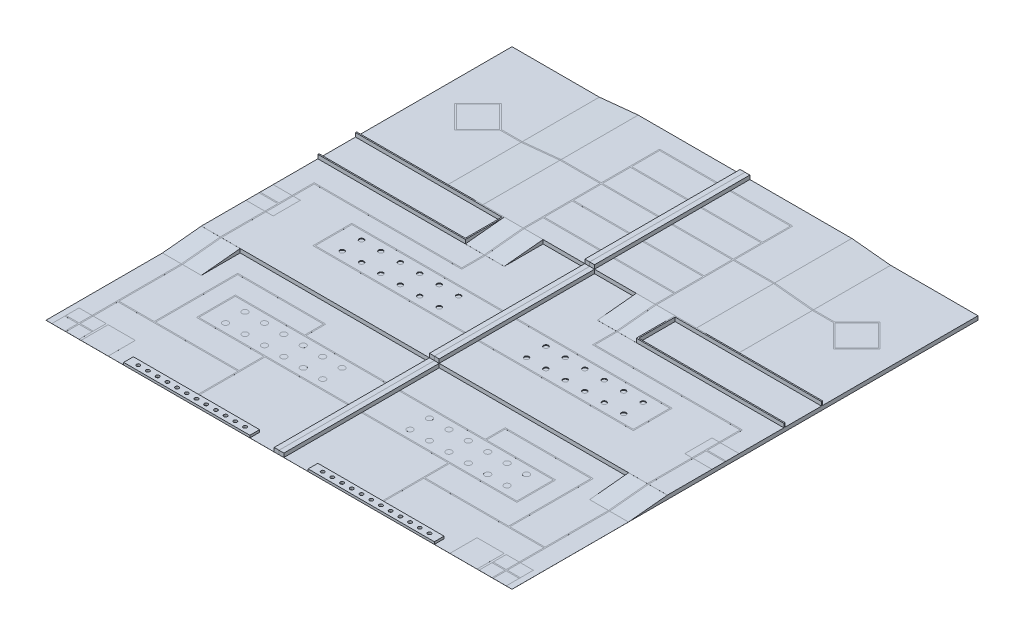
from build123d import *

# Parameters (mm, degrees)
SKETCH1_W            = 6000
SKETCH1_H            = 1
BOSS_EXTRUDE1_DEPTH  = 6000
SKETCH15_W           = 125
SKETCH15_H           = 12000
BOSS_EXTRUDE5_DEPTH  = 300
SKETCH17_W           = 5875
SKETCH17_H           = 4000
BOSS_EXTRUDE6_DEPTH  = 200
SKETCH19_W           = 5875
SKETCH19_H           = 4000
BOSS_EXTRUDE7_DEPTH  = 100
SKETCH20_W           = 700
SKETCH20_H           = 700
BOSS_EXTRUDE8_DEPTH  = 0.1
BOSS_EXTRUDE9_DEPTH  = 0.1
SKETCH23_W           = 700
SKETCH23_H           = 700
BOSS_EXTRUDE10_DEPTH = 0.1
SKETCH24_W           = 3250
SKETCH24_H           = 250
BOSS_EXTRUDE11_DEPTH = 60
SKETCH25_R           = 45
CUT_EXTRUDE2_DEPTH   = 59.5
BOSS_EXTRUDE15_DEPTH = 0.1
CUT_EXTRUDE3_DEPTH   = 0.1
SKETCH28_W           = 1000
SKETCH28_H           = 1000
BOSS_EXTRUDE16_DEPTH = 99
CHAMFER1_SIZE        = 98.999840601
CHAMFER1_SIZE_2      = 1000
SKETCH30_W           = 30
SKETCH30_H           = 1004.888551035
BOSS_EXTRUDE17_DEPTH = 0.1
SKETCH32_W           = 700
SKETCH32_H           = 700
BOSS_EXTRUDE18_DEPTH = 0.1
BOSS_EXTRUDE19_DEPTH = 0.1
BOSS_EXTRUDE20_DEPTH = 0.1
SKETCH29_R           = 75
BOSS_EXTRUDE21_DEPTH = 0.1
SKETCH35_W           = 30
SKETCH35_H           = 1150.009851823
BOSS_EXTRUDE22_DEPTH = 0.1
SKETCH36_W           = 1000
SKETCH36_H           = 1000
BOSS_EXTRUDE23_DEPTH = 100.01
BOSS_EXTRUDE24_DEPTH = 100.1
CHAMFER2_SIZE2       = 98.999840601
CHAMFER2_SIZE        = 1000
SKETCH39_W           = 30
SKETCH39_H           = 1004.988054447
BOSS_EXTRUDE25_DEPTH = 0.1
SKETCH40_R           = 60
CUT_EXTRUDE4_DEPTH   = 20
LPATTERN1_COUNT      = 6
LPATTERN1_PITCH      = 500
SKETCH41_W           = 2250
SKETCH41_H           = 4000
CUT_EXTRUDE5_DEPTH   = 100
CHAMFER4_SIZE        = 1000
CHAMFER4_SIZE2       = 99.989526659
BOSS_EXTRUDE27_DEPTH = 0.01
SKETCH44_W           = 1004.987514964
SKETCH44_H           = 30
BOSS_EXTRUDE28_DEPTH = 0.01
BOSS_EXTRUDE30_DEPTH = 0.1
SKETCH48_W           = 125
SKETCH48_H           = 4000
CUT_EXTRUDE8_DEPTH   = 200
SKETCH49_W           = 125
SKETCH49_H           = 4000
CUT_EXTRUDE9_DEPTH   = 100


# Some blends are built 0.0001 mm under size
with BuildPart() as part:
    # Sketch1 → Boss-Extrude1 (new, symmetric)
    with BuildSketch(Plane.XY):
        with Locations((3000, 0.5)):
            Rectangle(SKETCH1_W, SKETCH1_H)
    extrude(amount=BOSS_EXTRUDE1_DEPTH, both=True)

    # Sketch15 → Boss-Extrude5 (add)
    with BuildSketch(Plane(origin=(0, 1, 0), x_dir=(1, 0, 0), z_dir=(0, 1, 0))):
        with Locations((62.5, 0)):
            Rectangle(SKETCH15_W, SKETCH15_H)
    extrude(amount=BOSS_EXTRUDE5_DEPTH)

    # Sketch17 → Boss-Extrude6 (add)
    with BuildSketch(Plane(origin=(0, 1, 0), x_dir=(1, 0, 0), z_dir=(0, 1, 0))):
        with Locations((3062.5, 4000)):
            Rectangle(SKETCH17_W, SKETCH17_H)
    extrude(amount=BOSS_EXTRUDE6_DEPTH)

    # Sketch19 → Boss-Extrude7 (add)
    with BuildSketch(Plane(origin=(0, 1, 0), x_dir=(1, 0, 0), z_dir=(0, 1, 0))):
        with Locations((3062.5, 0)):
            Rectangle(SKETCH19_W, SKETCH19_H)
    extrude(amount=BOSS_EXTRUDE7_DEPTH)

    # Sketch20 → Boss-Extrude8 (add)
    with BuildSketch(Plane(origin=(0, 1, 0), x_dir=(1, 0, 0), z_dir=(0, 1, 0))):
        with Locations((5500, -5650)):
            Rectangle(SKETCH20_W, SKETCH20_H)
    extrude(amount=BOSS_EXTRUDE8_DEPTH)

    # Sketch21 → Boss-Extrude9 (add)
    with BuildSketch(Plane(origin=(0, 1.1, 0), x_dir=(1, 0, 0), z_dir=(0, 1, 0))):
        Polygon((5485, -5300), (5515, -5300), (5515, -5635), (5850, -5635), (5850, -5665), (5515, -5665), (5515, -6000), (5485, -6000), (5485, -5665), (5150, -5665), (5150, -5635), (5485, -5635), align=None)
    extrude(amount=BOSS_EXTRUDE9_DEPTH)

    # Sketch23 → Boss-Extrude10 (add)
    with BuildSketch(Plane(origin=(0, 1, 0), x_dir=(1, 0, 0), z_dir=(0, 1, 0))):
        with Locations((4750, -5650)):
            Rectangle(SKETCH23_W, SKETCH23_H)
    extrude(amount=BOSS_EXTRUDE10_DEPTH)

    # Sketch24 → Boss-Extrude11 (add)
    with BuildSketch(Plane(origin=(0, 1, 0), x_dir=(1, 0, 0), z_dir=(0, 1, 0))):
        with Locations((2375, -5875)):
            Rectangle(SKETCH24_W, SKETCH24_H)
    extrude(amount=BOSS_EXTRUDE11_DEPTH)

    # Sketch25 → Cut-Extrude2 (cut)
    with BuildSketch(Plane(origin=(0, 61, 0), x_dir=(1, 0, 0), z_dir=(0, 1, 0))):
        with Locations(Location((1000, -5875, 0), (0, 0, 180))):
            Circle(SKETCH25_R)
        with Locations(Location((1250, -5875, 0), (0, 0, 180))):
            Circle(SKETCH25_R)
        with Locations(Location((1500, -5875, 0), (0, 0, 180))):
            Circle(SKETCH25_R)
        with Locations(Location((1750, -5875, 0), (0, 0, 180))):
            Circle(SKETCH25_R)
        with Locations(Location((2000, -5875, 0), (0, 0, 180))):
            Circle(SKETCH25_R)
        with Locations(Location((2250, -5875, 0), (0, 0, 180))):
            Circle(SKETCH25_R)
        with Locations(Location((2500, -5875, 0), (0, 0, 180))):
            Circle(SKETCH25_R)
        with Locations(Location((2750, -5875, 0), (0, 0, 180))):
            Circle(SKETCH25_R)
        with Locations(Location((3000, -5875, 0), (0, 0, 180))):
            Circle(SKETCH25_R)
        with Locations(Location((3250, -5875, 0), (0, 0, 180))):
            Circle(SKETCH25_R)
        with Locations(Location((3500, -5875, 0), (0, 0, 180))):
            Circle(SKETCH25_R)
        with Locations(Location((3750, -5875, 0), (0, 0, 180))):
            Circle(SKETCH25_R)
    extrude(amount=-CUT_EXTRUDE2_DEPTH, mode=Mode.SUBTRACT)

    # Sketch26 → Boss-Extrude15 (add)
    with BuildSketch(Plane(origin=(0, 1, 0), x_dir=(1, 0, 0), z_dir=(0, 1, 0))):
        Polygon((2360, -5750), (2360, -4000), (125, -4000), (125, -3970), (4095, -3970), (4095, -3030), (125, -3030), (125, -3000), (2310, -3000), (2310, -2485), (4578, -2485), (4578, -4635), (5485, -4635), (5485, -3000), (5515, -3000), (5515, -5300), (5485, -5300), (5485, -4665), (2390, -4665), (2390, -5750), align=None)
    extrude(amount=BOSS_EXTRUDE15_DEPTH)

    # Sketch27 → Cut-Extrude3 (cut)
    with BuildSketch(Plane(origin=(0, 1.1, 0), x_dir=(1, 0, 0), z_dir=(0, 1, 0))):
        Polygon((2340, -3000), (2340, -2515), (4548, -2515), (4548, -4635), (2390, -4635), (2390, -4000), (4125, -4000), (4125, -3000), align=None)
    extrude(amount=-CUT_EXTRUDE3_DEPTH, mode=Mode.SUBTRACT)

    # Sketch28 → Boss-Extrude16 (add)
    with BuildSketch(Plane(origin=(0, 1, 0), x_dir=(1, 0, 0), z_dir=(0, 1, 0))):
        with Locations((5500, -2500)):
            Rectangle(SKETCH28_W, SKETCH28_H)
    extrude(amount=BOSS_EXTRUDE16_DEPTH)

    # Chamfer1
    # the kernel refuses this chamfer: 1000, 98.999840601 mm, written as the material it takes off along each edge
    with BuildSketch(Plane(origin=(2400.467806875, 100, 3000), x_dir=(0, -0.9326978341569289, 0.36065877246917777), z_dir=(1, 0, 0))) as chamfer1_piece_1_section:
        Polygon((CHAMFER1_SIZE * 0.932697834159, CHAMFER1_SIZE * 0.36065877247), (-CHAMFER1_SIZE_2 * 0.360658772469, CHAMFER1_SIZE_2 * 0.932697834157), (0, 0), align=None)
    chamfer1_piece_1 = extrude(amount=6199.064386251, mode=Mode.PRIVATE)
    chamfer1_piece_1 = split(chamfer1_piece_1, bisect_by=Plane(origin=(5485, 1.0667198, 2999.663835818), z_dir=(-1, 0, 0)), keep=Keep.TOP, mode=Mode.PRIVATE)
    chamfer1_piece_1 = split(chamfer1_piece_1, bisect_by=Plane(origin=(4578, 1.0667198, 2999.663835818), z_dir=(1, 0, 0)), keep=Keep.TOP, mode=Mode.PRIVATE)
    add(chamfer1_piece_1, mode=Mode.SUBTRACT)
    with BuildSketch(Plane(origin=(2400.467806875, 100, 3000), x_dir=(0, -0.9326978341569289, 0.36065877246917777), z_dir=(1, 0, 0))) as chamfer1_piece_2_section:
        Polygon((CHAMFER1_SIZE * 0.932697834159, CHAMFER1_SIZE * 0.36065877247), (-CHAMFER1_SIZE_2 * 0.360658772469, CHAMFER1_SIZE_2 * 0.932697834157), (0, 0), align=None)
    chamfer1_piece_2 = extrude(amount=6199.064386251, mode=Mode.PRIVATE)
    chamfer1_piece_2 = split(chamfer1_piece_2, bisect_by=Plane(origin=(5500, 1.1, 2666.666327989), z_dir=(0, 1, 0)), keep=Keep.TOP, mode=Mode.PRIVATE)
    add(chamfer1_piece_2, mode=Mode.SUBTRACT)
    with BuildSketch(Plane(origin=(2400.467806875, 100, 3000), x_dir=(0, -0.9326978341569289, 0.36065877246917777), z_dir=(1, 0, 0))) as chamfer1_piece_3_section:
        Polygon((CHAMFER1_SIZE * 0.932697834159, CHAMFER1_SIZE * 0.36065877247), (-CHAMFER1_SIZE_2 * 0.360658772469, CHAMFER1_SIZE_2 * 0.932697834157), (0, 0), align=None)
    chamfer1_piece_3 = extrude(amount=6199.064386251, mode=Mode.PRIVATE)
    chamfer1_piece_3 = split(chamfer1_piece_3, bisect_by=Plane(origin=(5515, 1.0667198, 2999.663835818), z_dir=(1, 0, 0)), keep=Keep.TOP, mode=Mode.PRIVATE)
    add(chamfer1_piece_3, mode=Mode.SUBTRACT)

    # Sketch30 → Boss-Extrude17 (add)
    with BuildSketch(Plane(origin=(0, 295.107343443, 29.215579961), x_dir=(1, 0, 0), z_dir=(0, 0.9951352461901817, 0.09851823074947541))):
        with Locations((5500, -2482.862944823)):
            Rectangle(SKETCH30_W, SKETCH30_H)
    extrude(amount=BOSS_EXTRUDE17_DEPTH)

    # Sketch32 → Boss-Extrude18 (add)
    with BuildSketch(Plane(origin=(0, 101, 0), x_dir=(1, 0, 0), z_dir=(0, 1, 0))):
        with Locations((5650, -500)):
            Rectangle(SKETCH32_W, SKETCH32_H)
    extrude(amount=BOSS_EXTRUDE18_DEPTH)

    # Sketch33 → Boss-Extrude19 (add)
    with BuildSketch(Plane(origin=(0, 101.1, 0), x_dir=(1, 0, 0), z_dir=(0, 1, 0))):
        Polygon((6000, -485), (6000, -515), (5515, -515), (5515, -850), (5485, -850), (5485, -150), (5515, -150), (5515, -485), align=None)
    extrude(amount=BOSS_EXTRUDE19_DEPTH)

    # Sketch31 → Boss-Extrude20 (add)
    with BuildSketch(Plane(origin=(0, 101, 0), x_dir=(1, 0, 0), z_dir=(0, 1, 0))):
        Polygon((125, 0), (4125, 0), (4125, -1000), (125, -1000), (125, -970), (4095, -970), (4095, -30), (125, -30), align=None)
    extrude(amount=BOSS_EXTRUDE20_DEPTH)

    # Sketch29 → Boss-Extrude21 (add)
    with BuildSketch(Plane(origin=(0, 1, 0), x_dir=(1, 0, 0), z_dir=(0, 1, 0))):
        with Locations((1125, -3250)):
            Circle(SKETCH29_R)
        with Locations((1125, -3750)):
            Circle(SKETCH29_R)
        with Locations((1625, -3750)):
            Circle(SKETCH29_R)
        with Locations((1625, -3250)):
            Circle(SKETCH29_R)
        with Locations((2125, -3750)):
            Circle(SKETCH29_R)
        with Locations((2125, -3250)):
            Circle(SKETCH29_R)
        with Locations((2625, -3750)):
            Circle(SKETCH29_R)
        with Locations((2625, -3250)):
            Circle(SKETCH29_R)
        with Locations((3125, -3750)):
            Circle(SKETCH29_R)
        with Locations((3125, -3250)):
            Circle(SKETCH29_R)
        with Locations((3625, -3750)):
            Circle(SKETCH29_R)
        with Locations((3625, -3250)):
            Circle(SKETCH29_R)
    extrude(amount=BOSS_EXTRUDE21_DEPTH)

    # Sketch35 → Boss-Extrude22 (add)
    with BuildSketch(Plane(origin=(0, 101, 0), x_dir=(1, 0, 0), z_dir=(0, 1, 0))):
        Polygon((5485, -150), (5485, 390), (1685, 390), (1685, 1000), (1715, 1000), (1715, 420), (5515, 420), (5515, -150), align=None)
        with Locations((5500, -1425.004925912)):
            Rectangle(SKETCH35_W, SKETCH35_H)
    extrude(amount=BOSS_EXTRUDE22_DEPTH)

    # Sketch36 → Boss-Extrude23 (add)
    with BuildSketch(Plane(origin=(0, 101, 0), x_dir=(1, 0, 0), z_dir=(0, 1, 0))):
        with Locations((1700, 1500)):
            Rectangle(SKETCH36_W, SKETCH36_H)
    extrude(amount=BOSS_EXTRUDE23_DEPTH)

    # Sketch37 → Boss-Extrude24 (add)
    with BuildSketch(Plane(origin=(0, 101, 0), x_dir=(1, 0, 0), z_dir=(0, 1, 0))):
        Polygon((6000, 1000), (2200, 1000), (2200, 2000), (6000, 2000), (6000, 1970), (2230, 1970), (2230, 1030), (6000, 1030), align=None)
    extrude(amount=BOSS_EXTRUDE24_DEPTH)

    # Chamfer2
    chamfer2_edges = [part.edges().sort_by_distance(p)[0] for p in [
        (1700, 201.01, -1000),
    ]]
    chamfer2_side = [part.faces().sort_by_distance(p)[0] for p in [
        (1700, 201.01, -1001.979996812),
    ]]
    chamfer(chamfer2_edges, length=CHAMFER2_SIZE - 0.0001, length2=CHAMFER2_SIZE2 - 0.0001, reference=chamfer2_side[0])  # a hair under: the kernel refuses the full size

    # Sketch39 → Boss-Extrude25 (add)
    with BuildSketch(Plane(origin=(0, 2.98110112, 0.295128536), x_dir=(1, 0, 0), z_dir=(0, 0.9951352461901827, 0.09851823074946477))):
        with Locations((1700, 1507.57961472)):
            Rectangle(SKETCH39_W, SKETCH39_H)
    extrude(amount=BOSS_EXTRUDE25_DEPTH)

    # Sketch40 → Cut-Extrude4 (cut)
    with BuildSketch(Plane(origin=(0, 101, 0), x_dir=(1, 0, 0), z_dir=(0, 1, 0))):
        with Locations(Location((1125, -250, 0), (0, 0, 180))):
            Circle(SKETCH40_R)
        with Locations(Location((1125, -750, 0), (0, 0, 180))):
            Circle(SKETCH40_R)
    cut_extrude4 = extrude(amount=-CUT_EXTRUDE4_DEPTH, mode=Mode.SUBTRACT)

    # LPattern1: Cut-Extrude4 ×6
    with Locations(*[(i * LPATTERN1_PITCH, 0, 0) for i in range(1, LPATTERN1_COUNT)]):
        add(cut_extrude4, mode=Mode.SUBTRACT)

    # Sketch41 → Cut-Extrude5 (cut)
    with BuildSketch(Plane(origin=(0, 201, 0), x_dir=(1, 0, 0), z_dir=(0, 1, 0))):
        with Locations((4875, 4000)):
            Rectangle(SKETCH41_W, SKETCH41_H)
    extrude(amount=-CUT_EXTRUDE5_DEPTH, mode=Mode.SUBTRACT)

    # Chamfer4
    chamfer4_edges = [part.edges().sort_by_distance(p)[0] for p in [
        (3750, 201, -4000),
    ]]
    chamfer4_side = [part.faces().sort_by_distance(p)[0] for p in [
        (1937.5, 201, -4000),
    ]]
    chamfer(chamfer4_edges, length=CHAMFER4_SIZE, length2=CHAMFER4_SIZE2, reference=chamfer4_side[0])

    # Sketch43 → Boss-Extrude27 (add)
    with BuildSketch(Plane(origin=(0, 201, 0), x_dir=(1, 0, 0), z_dir=(0, 1, 0))):
        Polygon((1685, 2000), (1685, 2485), (125, 2485), (125, 2515), (1685, 2515), (1685, 3235), (125, 3235), (125, 3265), (1685, 3265), (1685, 3985), (125, 3985), (125, 4015), (1685, 4015), (1685, 4735), (125, 4735), (125, 4765), (1685, 4765), (1685, 5485), (125, 5485), (125, 5515), (1715, 5515), (1715, 4015), (2750, 4015), (2750, 3985), (1715, 3985), (1715, 2000), align=None)
    extrude(amount=BOSS_EXTRUDE27_DEPTH)

    # Sketch44 → Boss-Extrude28 (add)
    with BuildSketch(Plane(origin=(47.121023287, 471.259589497, 0), x_dir=(0.9950382219757864, -0.09949340082269571, 0), z_dir=(0.09949340082269571, 0.9950382219757864, 0))):
        with Locations((3218.849699416, 4000)):
            Rectangle(SKETCH44_W, SKETCH44_H)
    extrude(amount=BOSS_EXTRUDE28_DEPTH)

    # Sketch48 → Cut-Extrude8 (cut)
    with BuildSketch(Plane(origin=(0, 301, 0), x_dir=(1, 0, 0), z_dir=(0, 1, 0))):
        with Locations((62.5, -4000)):
            Rectangle(SKETCH48_W, SKETCH48_H)
    extrude(amount=-CUT_EXTRUDE8_DEPTH, mode=Mode.SUBTRACT)

    # Sketch49 → Cut-Extrude9 (cut)
    with BuildSketch(Plane(origin=(0, 301, 0), x_dir=(1, 0, 0), z_dir=(0, 1, 0))):
        with Locations((62.5, 0)):
            Rectangle(SKETCH49_W, SKETCH49_H)
    extrude(amount=-CUT_EXTRUDE9_DEPTH, mode=Mode.SUBTRACT)


with BuildPart() as body_2:
    # Sketch45 → Boss-Extrude30 (new body)
    with BuildSketch(Plane(origin=(0, 101, 0), x_dir=(1, 0, 0), z_dir=(0, 1, 0))):
        Polygon((3750.000994934, 4015), (3750, 3985), (4289.000994934, 3985), (4874.918474747, 3399), (5476, 4000), (4874.918474747, 4601), (4289.000994934, 4015), align=None)
        Polygon((4316.426526971, 4000), (4874.921407153, 3441.42646181), (5433.570715474, 4000), (4874.921407153, 4558.57353819), align=None, mode=Mode.SUBTRACT)
    extrude(amount=BOSS_EXTRUDE30_DEPTH)


with BuildPart() as body_3:
    # Mirror3: mirrored copy
    add(part.part.mirror(Plane(origin=(0, 1, 6000), x_dir=(0, 0, 1), z_dir=(1, 0, 0))))


with BuildPart() as body_4:
    # Mirror3 2: mirrored copy
    add(body_2.part.mirror(Plane(origin=(0, 1, 6000), x_dir=(0, 0, 1), z_dir=(1, 0, 0))))


solid = Compound([part.part, body_2.part, body_3.part, body_4.part])
